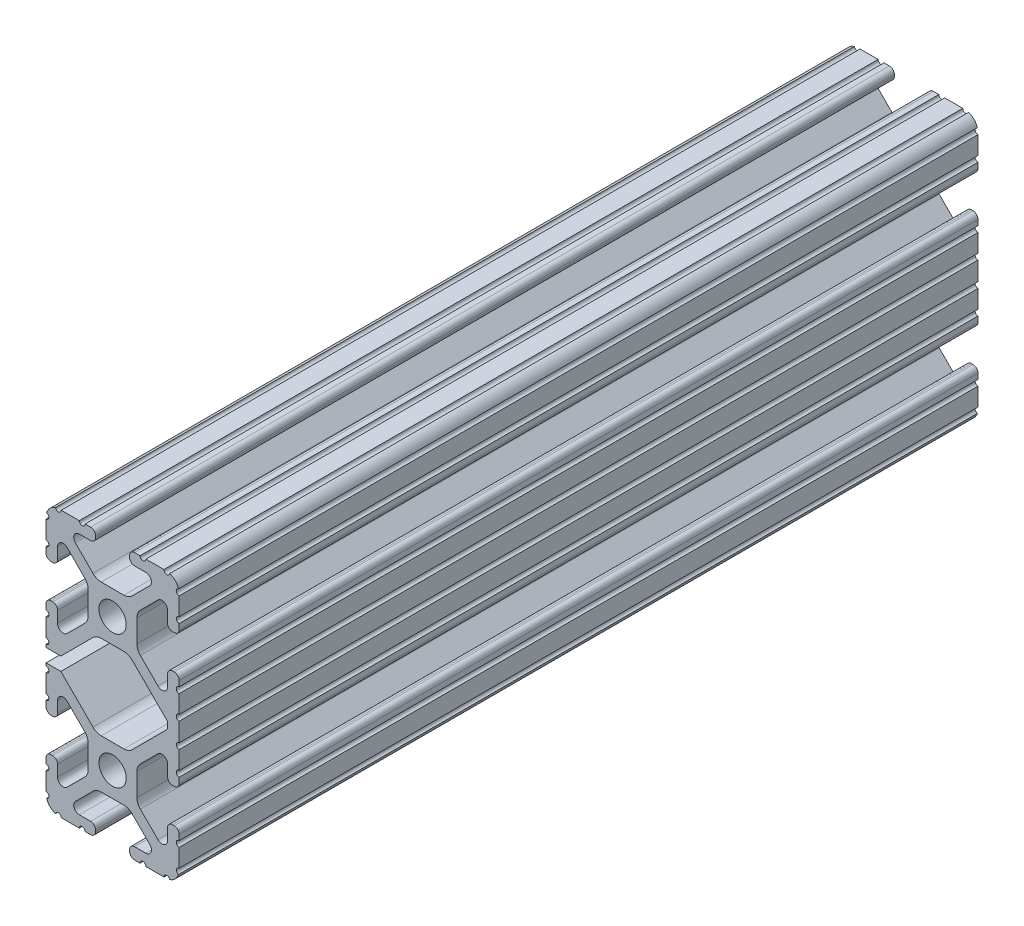
from build123d import *

# Parameters (mm, degrees)
BOSS_EXTRUDE1_DEPTH     = 76.2
CUT_EXTRUDE1_DEPTH      = 82.319677815
CUT_EXTRUDE1_DEPTH_BACK = 82.319677815
SKETCH5_R               = 0.55245
BOSS_EXTRUDE2_DEPTH     = 76.2
CUT_EXTRUDE2_DEPTH      = 82.319677815
CUT_EXTRUDE2_DEPTH_BACK = 82.319677815
CUT_EXTRUDE3_DEPTH      = 83.173962076
CUT_EXTRUDE3_DEPTH_BACK = 83.173962076
SKETCH9_R               = 3.175
CUT_EXTRUDE5_DEPTH      = 156.023256418
CUT_EXTRUDE5_DEPTH_BACK = 156.023256418
SKETCH10_W              = 10.576222102
SKETCH10_H              = 2.54


with BuildPart() as part:
    # Sketch4 → Boss-Extrude1 (new, symmetric)
    with BuildSketch(Plane.XY):
        with BuildLine():
            Line((4.190365, -25.4), (10.11729625, -25.4))
            ThreePointArc((10.11729625, -25.4), (11.943543585, -24.643543585), (12.7, -22.81729625))
            Line((12.7, -22.81729625), (12.7, -16.890365))
            ThreePointArc((12.7, -16.890365), (12.42492494, -16.22627506), (11.760835, -15.9512))
            Line((11.760835, -15.9512), (11.429365, -15.9512))
            ThreePointArc((11.429365, -15.9512), (10.76527506, -16.22627506), (10.4902, -16.890365))
            Line((10.4902, -16.890365), (10.4902, -19.048478019))
            ThreePointArc((10.4902, -19.048478019), (9.830707141, -20.035478831), (8.666460301, -19.803895736))
            Line((8.666460301, -19.803895736), (5.299899128, -16.437334563))
            ThreePointArc((5.299899128, -16.437334563), (4.817571085, -15.715479634), (4.6482, -14.86399369))
            Line((4.6482, -14.86399369), (4.6482, -12.7))
            Line((4.6482, -12.7), (2.6035, -12.7))
            ThreePointArc((2.6035, -12.7), (1.840952505, -14.540952505), (0, -15.3035))
            Line((0, -15.3035), (0, -17.3482))
            Line((0, -17.3482), (2.16399369, -17.3482))
            ThreePointArc((2.16399369, -17.3482), (3.015479634, -17.517571085), (3.737334563, -17.999899128))
            Line((3.737334563, -17.999899128), (7.103895736, -21.366460301))
            ThreePointArc((7.103895736, -21.366460301), (7.335478831, -22.530707141), (6.348478019, -23.1902))
            Line((6.348478019, -23.1902), (4.190365, -23.1902))
            ThreePointArc((4.190365, -23.1902), (3.52627506, -23.46527506), (3.2512, -24.129365))
            Line((3.2512, -24.129365), (3.2512, -24.460835))
            ThreePointArc((3.2512, -24.460835), (3.52627506, -25.12492494), (4.190365, -25.4))
        make_face()
    extrude(amount=BOSS_EXTRUDE1_DEPTH, both=True)

    # Sketch5 → Cut-Extrude1 (cut, two sides: drawn at the far end of the back side and taken through both)
    with BuildSketch(Plane.XY.offset(-CUT_EXTRUDE1_DEPTH_BACK)):
        with Locations((10.356153152, -25.4)):
            Circle(SKETCH5_R)
        with Locations((5.796028019, -25.4)):
            Circle(SKETCH5_R)
        with Locations((12.7, -23.056153152)):
            Circle(SKETCH5_R)
        with Locations((12.7, -18.496028019)):
            Circle(SKETCH5_R)
    extrude(amount=CUT_EXTRUDE1_DEPTH + CUT_EXTRUDE1_DEPTH_BACK, mode=Mode.SUBTRACT)

    # Mirror1: part across plane


with BuildPart() as part_1:
    add(part.part)
    add(part.part.mirror(Plane(origin=(4.6482, -12.7, 76.2), x_dir=(0, 0, 1), z_dir=(0, -1, 0))))

    # Sketch6 → Boss-Extrude2 (add, symmetric)
    with BuildSketch(Plane.XY):
        with BuildLine():
            Line((12.7, -1.791396848), (12.7, 0))
            Line((12.7, 0), (9.803703152, 0))
            Line((9.803703152, 0), (9.803703152, -2.343846848))
            Line((9.803703152, -2.343846848), (12.14755, -2.343846848))
            ThreePointArc((12.14755, -2.343846848), (12.309358859, -1.953205706), (12.7, -1.791396848))
        make_face()
    extrude(amount=BOSS_EXTRUDE2_DEPTH, both=True)

    # Sketch7 → Cut-Extrude2 (cut, two sides: drawn at the far end of the back side and taken through both)
    with BuildSketch(Plane.XY.offset(-CUT_EXTRUDE2_DEPTH_BACK)):
        with BuildLine():
            Line((5.420615149, -5.716820286), (10.328391141, -0.809044294))
            ThreePointArc((10.328391141, -0.809044294), (10.448147248, -0.629816615), (10.4902, -0.418403152))
            Line((10.4902, -0.418403152), (10.4902, 0))
            Line((10.4902, 0), (0, 0))
            Line((0, 0), (5.420615149, -5.716820286))
        make_face()
    extrude(amount=CUT_EXTRUDE2_DEPTH + CUT_EXTRUDE2_DEPTH_BACK, mode=Mode.SUBTRACT)

    # Mirror2: part across plane


with BuildPart() as part_2:
    add(part_1.part)
    add(part_1.part.mirror(Plane.ZX))

    # Mirror3: part across plane


with BuildPart() as part_3:
    add(part_2.part)
    add(part_2.part.mirror(Plane(origin=(0, 0, 0), x_dir=(0, 0, 1), z_dir=(1, 0, 0))))

    # Sketch9 → Cut-Extrude3 (cut, two sides: drawn at the far end of the back side and taken through both)
    with BuildSketch(Plane(origin=(4.6482, 0, 0), x_dir=(0, 0, -1), z_dir=(1, 0, 0)).offset(-CUT_EXTRUDE3_DEPTH_BACK)):
        with Locations((-63.5, 12.7)):
            Circle(SKETCH9_R)
        with Locations((63.5, 12.7)):
            Circle(SKETCH9_R)
        with Locations((63.5, -12.7)):
            Circle(SKETCH9_R)
        with Locations((-63.5, -12.7)):
            Circle(SKETCH9_R)
    extrude(amount=CUT_EXTRUDE3_DEPTH + CUT_EXTRUDE3_DEPTH_BACK, mode=Mode.SUBTRACT)

    # Sketch10 → Cut-Extrude5 (cut, two sides: drawn at the far end of the back side and taken through both)
    with BuildSketch(Plane.XY.offset(76.2).offset(-CUT_EXTRUDE5_DEPTH_BACK)):
        with Locations((-12.7, 0)):
            Rectangle(SKETCH10_W, SKETCH10_H)
    extrude(amount=CUT_EXTRUDE5_DEPTH + CUT_EXTRUDE5_DEPTH_BACK, mode=Mode.SUBTRACT)


solid = part_3.part
